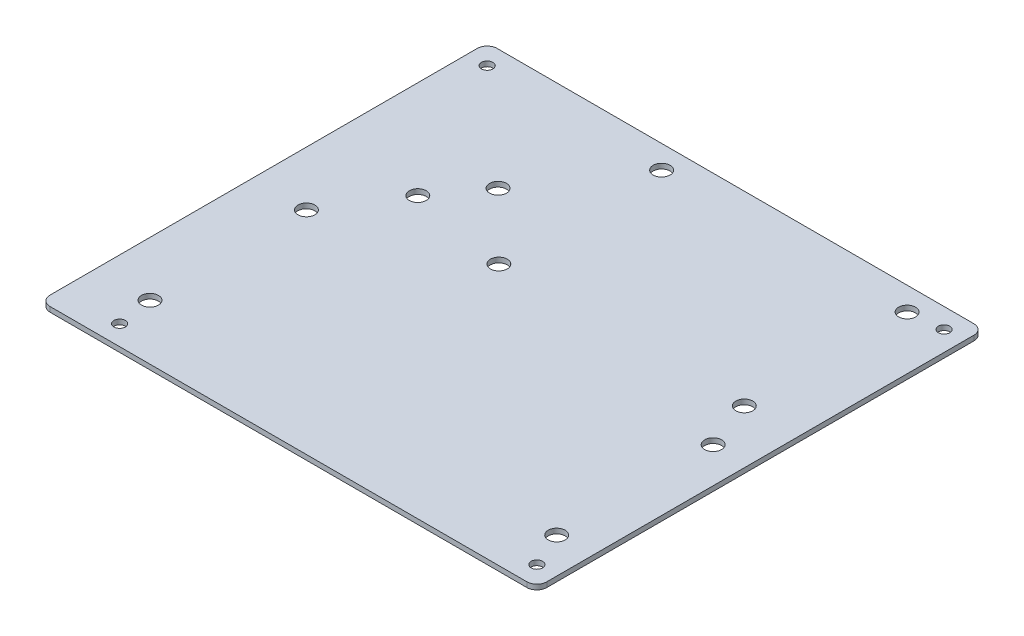
from build123d import *

# Parameters (mm, degrees)
SKETCH1_W           = 158.75
SKETCH1_H           = 142.875
BOSS_EXTRUDE1_DEPTH = 1.6002
FILLET1_R           = 3.175
SKETCH2_R           = 1.8288
CUT_EXTRUDE1_DEPTH  = 214.582276336
SKETCH5_R           = 2.7051
CUT_EXTRUDE2_DEPTH  = 214.582276336


with BuildPart() as part:
    # Sketch1 → Boss-Extrude1 (new body)
    with BuildSketch(Plane(origin=(0, 0, 0), x_dir=(1, 0, 0), z_dir=(0, 1, 0))):
        with Locations((79.375, 71.4375)):
            Rectangle(SKETCH1_W, SKETCH1_H)
    extrude(amount=BOSS_EXTRUDE1_DEPTH)

    # Fillet1
    fillet1_edges = [part.edges().sort_by_distance(p)[0] for p in [
        (158.75, 0.8001, 0),
        (0, 0.8001, -142.875),
        (158.75, 0.8001, -142.875),
        (0, 0.8001, 0),
    ]]
    fillet(fillet1_edges, radius=FILLET1_R)

    # Sketch2 → Cut-Extrude1 (cut, through all)
    with BuildSketch(Plane(origin=(0, 1.6002, 0), x_dir=(1, 0, 0), z_dir=(0, 1, 0))):
        with Locations((6.35, 136.525)):
            Circle(SKETCH2_R)
        with Locations((152.4, 136.525)):
            Circle(SKETCH2_R)
        with Locations((152.4, 6.35)):
            Circle(SKETCH2_R)
        with Locations((19.05, 6.35)):
            Circle(SKETCH2_R)
    extrude(amount=-CUT_EXTRUDE1_DEPTH, mode=Mode.SUBTRACT)

    # Sketch5 → Cut-Extrude2 (cut, through all)
    with BuildSketch(Plane(origin=(0, 1.6002, 0), x_dir=(1, 0, 0), z_dir=(0, 1, 0))):
        with Locations((63.163060068, 135.471484421)):
            Circle(SKETCH5_R)
        with Locations((141.663048443, 135.428762282)):
            Circle(SKETCH5_R)
        with Locations((63.134760053, 83.471492122)):
            Circle(SKETCH5_R)
        with Locations((141.634748427, 83.428769983)):
            Circle(SKETCH5_R)
        with Locations((17.4, 67.7)):
            Circle(SKETCH5_R)
        with Locations((147.382, 67.721)):
            Circle(SKETCH5_R)
        with Locations((147.4, 17.7)):
            Circle(SKETCH5_R)
        with Locations((17.4, 17.7)):
            Circle(SKETCH5_R)
        with Locations((42.034284346, 104.322996338)):
            Circle(SKETCH5_R)
        with Locations((31.239286177, 89.464002808)):
            Circle(SKETCH5_R)
    extrude(amount=-CUT_EXTRUDE2_DEPTH, mode=Mode.SUBTRACT)


solid = part.part
